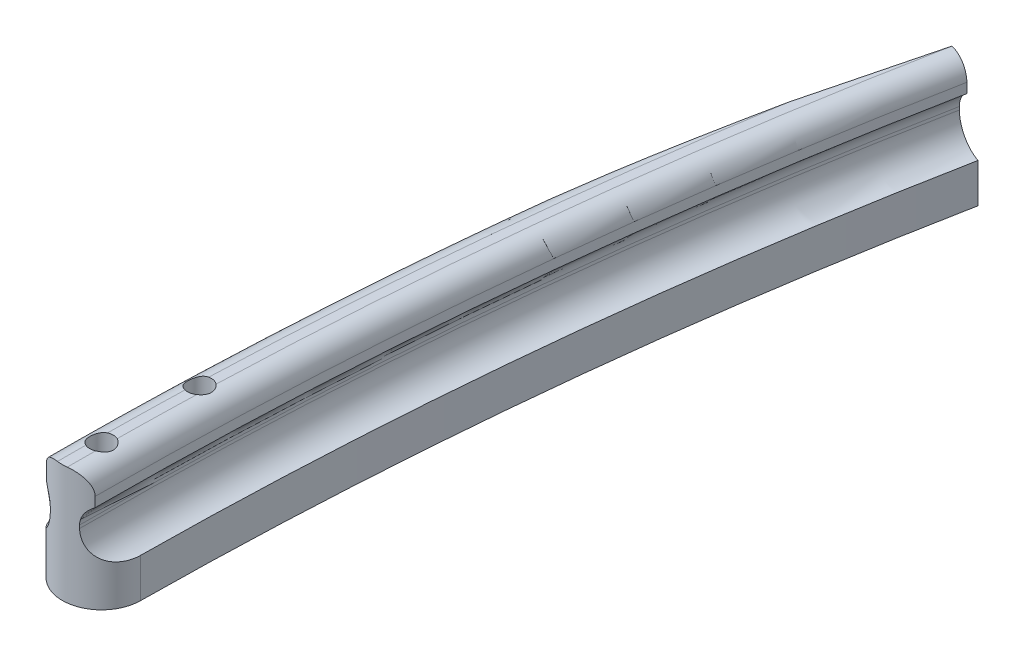
from build123d import *
from OCP.BRepAlgoAPI import BRepAlgoAPI_Cut
from OCP.TopTools import TopTools_ListOfShape

# Parameters (mm, degrees)
SKETCH_1_W                = 4
SKETCH_1_H                = 21.3823
SKETCH_1_H_2              = 8
EXTRUDE_1_DEPTH           = 4
SKETCH_1_7_W              = 44.5
SKETCH_1_7_H              = 8
EXTRUDE_2_DEPTH           = 3.5
SKETCH_2_W                = 18.5
SKETCH_2_H                = 1.5
CUT_EXTRUDE_1_DEPTH       = 38.072659107
SKETCH_2_3_W              = 2.5
SKETCH_2_3_H              = 1.5
EXTRUDE_4_DEPTH           = 29.3823
FILLET_1_R                = 1
FILLET_2_R                = 1.5
FILLET_3_R                = 1
REVOLVE_2_ANGLE           = 30
CUT_EXTRUDE_5_DEPTH       = 112.412872349
CUT_EXTRUDE_START         = -9
CUT_EXTRUDE_6_DEPTH       = 10
SKETCH_9_W                = 32.627713819
SKETCH_9_H                = 2
CUT_EXTRUDE_7_DEPTH       = 126.089275919
CUT_EXTRUDE_8_DEPTH       = 126.089275919
CUT_EXTRUDE_START_2       = -49.267691206
CUT_EXTRUDE_9_DEPTH       = 49.267691206
SKETCH_16_R               = 0.6
CUT_EXTRUDE_10_DEPTH      = 69.120571654
SKETCH_18_R               = 0.6
CUT_EXTRUDE_11_DEPTH      = 69.120571654
CUT_EXTRUDE_12_DEPTH      = 69.325780514
CUT_EXTRUDE_13_DEPTH      = 65.449078785
CUT_EXTRUDE_14_DEPTH      = 45.022808236
CUT_EXTRUDE_14_DEPTH_BACK = 45.022808236
SKETCH_21_W               = 59.665391343
SKETCH_21_H               = 19.859042977
CUT_EXTRUDE_15_DEPTH      = 60.110082836


with BuildPart() as part:
    # 草图1 → 凸台-拉伸1 (new body)
    with BuildSketch(Plane(origin=(0, 0, 0), x_dir=(1, 0, 0), z_dir=(0, 1, 0))):
        with Locations((-15.75, -4)):
            Rectangle(SKETCH_1_W, SKETCH_1_H)
        with Locations((15.75, -4)):
            Rectangle(SKETCH_1_W, SKETCH_1_H)
        with Locations((15.75, 10.69115)):
            Rectangle(SKETCH_1_W, SKETCH_1_H_2)
        with Locations((-15.75, 10.69115)):
            Rectangle(SKETCH_1_W, SKETCH_1_H_2)
    extrude(amount=EXTRUDE_1_DEPTH)

    # 草图1<7> → 凸台-拉伸2 (add)
    with BuildSketch(Plane(origin=(0, 0, 0), x_dir=(1, 0, 0), z_dir=(0, 1, 0))):
        with Locations((0, 10.69115)):
            Rectangle(SKETCH_1_7_W, SKETCH_1_7_H)
    extrude(amount=EXTRUDE_2_DEPTH)

    # 草图2 → 切除-拉伸1 (cut, through all)
    with BuildSketch(Plane(origin=(0, 0, -14.69115), x_dir=(-1, 0, 0), z_dir=(0, 0, -1))):
        with Locations((0, 2.75)):
            Rectangle(SKETCH_2_W, SKETCH_2_H)
        Polygon((13.25, 3.5), (9.25, 3.5), (9.25, 2), align=None)
        Polygon((-9.25, 3.5), (-13.25, 3.5), (-9.25, 2), align=None)
        Polygon((-22.25, 3.5), (-22.25, 2), (-18.25, 3.5), align=None)
        Polygon((22.25, 3.5), (18.25, 3.5), (22.25, 2), align=None)
    extrude(amount=-CUT_EXTRUDE_1_DEPTH, mode=Mode.SUBTRACT)

    # 草图2<3> → 凸台-拉伸4 (add, through all)
    with BuildSketch(Plane(origin=(0, 0, -14.69115), x_dir=(-1, 0, 0), z_dir=(0, 0, -1))):
        with Locations((-15.75, 7.25)):
            Rectangle(SKETCH_2_3_W, SKETCH_2_3_H)
        Polygon((-15, 6.5), (-16.5, 6.5), (-16.5, 4), (-15.75, 4), (-15, 4), align=None)
        with Locations((15.75, 7.25)):
            Rectangle(SKETCH_2_3_W, SKETCH_2_3_H)
        Polygon((16.5, 6.5), (15, 6.5), (15, 4), (15.75, 4), (16.5, 4), align=None)
    extrude(amount=-EXTRUDE_4_DEPTH)

    # 圆角1
    # the kernel refuses this fillet: 1 mm, written as the material it adds along each edge
    with BuildSketch(Plane(origin=(-16.5, 6.5, -14.69115), x_dir=(-1, 0, 0), z_dir=(0, 0, 1)), Plane(origin=(15, 6.5, -14.69115), x_dir=(-1, 0, 0), z_dir=(0, 0, 1))) as fillet_1_piece_1:
        with BuildLine():
            CenterArc((1, 0.866025404), FILLET_1_R, 180, 60)
            Line((0, 0.866025404), (-0.02, 0.866025404))
            Line((-0.02, 0.866025404), (-0.02, 0))
            Line((-0.02, 0), (0, -0.02))
            ThreePointArc((0, -0.02), (0.25, -0.02), (0.49, -0.017320508))
            Line((0.49, -0.017320508), (0.5, 0))
        make_face()
    extrude(amount=29.3823)
    with BuildSketch(Plane(origin=(-15, 6.5, -14.69115), x_dir=(0, -1, 0), z_dir=(0, 0, 1)), Plane(origin=(16.5, 6.5, -14.69115), x_dir=(0, -1, 0), z_dir=(0, 0, 1))) as fillet_1_piece_2:
        with BuildLine():
            CenterArc((0.866025404, 1), FILLET_1_R, 210, 60)
            Line((0, 0.5), (-0.017320508, 0.49))
            ThreePointArc((-0.017320508, 0.49), (-0.02, 0.25), (-0.02, 0))
            Line((-0.02, 0), (0, -0.02))
            Line((0, -0.02), (0.866025404, -0.02))
            Line((0.866025404, -0.02), (0.866025404, 0))
        make_face()
    extrude(amount=29.3823)

    # 圆角2
    # the kernel refuses this fillet: 1.5 mm, written as the material it adds along each edge
    with BuildSketch(Plane(origin=(16.5, 4, -14.69115), x_dir=(1, 0, 0), z_dir=(0, 0, 1))) as fillet_2_piece_1:
        with BuildLine():
            CenterArc((1.5, 1.479019946), FILLET_2_R, 180, 80.405931773)
            Line((0, 1.479019946), (-0.03, 1.479019946))
            Line((-0.03, 1.479019946), (-0.03, 0))
            Line((-0.03, 0), (0, -0.03))
            ThreePointArc((0, -0.03), (0.625, -0.03), (1.245, -0.029580399))
            Line((1.245, -0.029580399), (1.25, 0))
        make_face()
    extrude(amount=29.3823)
    with BuildSketch(Plane(origin=(15, 4, -14.69115), x_dir=(0, 1, 0), z_dir=(0, 0, 1)), Plane(origin=(-16.5, 4, -14.69115), x_dir=(0, 1, 0), z_dir=(0, 0, 1))) as fillet_2_piece_2:
        with BuildLine():
            CenterArc((1.479019946, 1.5), FILLET_2_R, 189.594068227, 80.405931773)
            Line((0, 1.25), (-0.029580399, 1.245))
            ThreePointArc((-0.029580399, 1.245), (-0.03, 0.625), (-0.03, 0))
            Line((-0.03, 0), (0, -0.03))
            Line((0, -0.03), (1.479019946, -0.03))
            Line((1.479019946, -0.03), (1.479019946, 0))
        make_face()
    extrude(amount=29.3823)
    with BuildSketch(Plane(origin=(-15, 4, -14.69115), x_dir=(0, 1, 0), z_dir=(0, 0, 1))) as fillet_2_piece_3:
        with BuildLine():
            CenterArc((1.479019946, -1.5), FILLET_2_R, 90, 80.405931773)
            Line((0, -1.25), (-0.029580399, -1.245))
            ThreePointArc((-0.029580399, -1.245), (-0.03, -0.625), (-0.03, 0))
            Line((-0.03, 0), (0, 0.03))
            Line((0, 0.03), (1.479019946, 0.03))
            Line((1.479019946, 0.03), (1.479019946, 0))
        make_face()
    extrude(amount=29.3823)

    # 圆角3
    fillet_3_edges = [part.edges().sort_by_distance(p)[0] for p in [
        (14.5, 8, 0),
        (17, 8, 0),
        (-17, 8, 0),
        (-14.5, 8, 0),
    ]]
    fillet(fillet_3_edges, radius=FILLET_3_R)

    # 草图7 → 旋转2 (revolve)
    with BuildSketch(Plane(origin=(0, 0, -14.69115), x_dir=(-1, 0, 0), z_dir=(0, 0, -1))):
        with BuildLine():
            Line((-17.75, 4), (-17.75, 3.5))
            Line((-17.75, 3.5), (-17.75, 0))
            Line((-17.75, 0), (-13.75, 0))
            Line((-13.75, 0), (-13.75, 3.5))
            Line((-13.75, 3.5), (-13.75, 4))
            ThreePointArc((-13.75, 4), (-14.645643924, 4.510774109), (-15, 5.479019946))
            Line((-15, 5.479019946), (-15, 5.633974596))
            ThreePointArc((-15, 5.633974596), (-14.866025404, 6.133974596), (-14.5, 6.5))
            Line((-14.5, 6.5), (-14.5, 7))
            ThreePointArc((-14.5, 7), (-14.792893219, 7.707106781), (-15.5, 8))
            Line((-15.5, 8), (-16, 8))
            ThreePointArc((-16, 8), (-16.707106781, 7.707106781), (-17, 7))
            Line((-17, 7), (-17, 6.5))
            ThreePointArc((-17, 6.5), (-16.633974596, 6.133974596), (-16.5, 5.633974596))
            Line((-16.5, 5.633974596), (-16.5, 5.479019946))
            ThreePointArc((-16.5, 5.479019946), (-16.854356076, 4.510774109), (-17.75, 4))
        make_face()
    revolve(axis=Axis((-200, 10, -14.69115), (0, 1, 0)), revolution_arc=REVOLVE_2_ANGLE)

    # 草图5 → 切除-拉伸5 (cut, through all)
    with BuildSketch(Plane(origin=(0, 0, -14.69115), x_dir=(-1, 0, 0), z_dir=(0, 0, -1))):
        with BuildLine():
            Line((17, 6.5), (17, 7))
            ThreePointArc((17, 7), (16.707106781, 7.707106781), (16, 8))
            Line((16, 8), (15.5, 8))
            ThreePointArc((15.5, 8), (14.792893219, 7.707106781), (14.5, 7))
            Line((14.5, 7), (14.5, 6.5))
            ThreePointArc((14.5, 6.5), (14.866025404, 6.133974596), (15, 5.633974596))
            Line((15, 5.633974596), (15, 5.479019946))
            ThreePointArc((15, 5.479019946), (14.645643924, 4.510774109), (13.75, 4))
            Line((13.75, 4), (13.75, 3.5))
            Line((13.75, 3.5), (13.25, 3.5))
            Line((13.25, 3.5), (9.25, 2))
            Line((9.25, 2), (-9.25, 2))
            Line((-9.25, 2), (-13.25, 3.5))
            Line((-13.25, 3.5), (-13.75, 3.5))
            Line((-13.75, 3.5), (-13.75, 4))
            ThreePointArc((-13.75, 4), (-14.645643924, 4.510774109), (-15, 5.479019946))
            Line((-15, 5.479019946), (-15, 5.633974596))
            ThreePointArc((-15, 5.633974596), (-14.866025404, 6.133974596), (-14.5, 6.5))
            Line((-14.5, 6.5), (-14.5, 7))
            ThreePointArc((-14.5, 7), (-14.792893219, 7.707106781), (-15.5, 8))
            Line((-15.5, 8), (-16, 8))
            ThreePointArc((-16, 8), (-16.707106781, 7.707106781), (-17, 7))
            Line((-17, 7), (-17, 6.5))
            ThreePointArc((-17, 6.5), (-16.633974596, 6.133974596), (-16.5, 5.633974596))
            Line((-16.5, 5.633974596), (-16.5, 5.479019946))
            ThreePointArc((-16.5, 5.479019946), (-16.854356076, 4.510774109), (-17.75, 4))
            Line((-17.75, 4), (-17.75, 3.5))
            Line((-17.75, 3.5), (-18.25, 3.5))
            Line((-18.25, 3.5), (-22.25, 2))
            Line((-22.25, 2), (-22.25, 0))
            Line((-22.25, 0), (22.25, 0))
            Line((22.25, 0), (22.25, 2))
            Line((22.25, 2), (18.25, 3.5))
            Line((18.25, 3.5), (17.75, 3.5))
            Line((17.75, 3.5), (17.75, 4))
            ThreePointArc((17.75, 4), (16.854356076, 4.510774109), (16.5, 5.479019946))
            Line((16.5, 5.479019946), (16.5, 5.633974596))
            ThreePointArc((16.5, 5.633974596), (16.633974596, 6.133974596), (17, 6.5))
        make_face()
    extrude(amount=-CUT_EXTRUDE_5_DEPTH, mode=Mode.SUBTRACT)

    # 切除-拉伸6: read off the stored shape, not the designer's step
    # 切除-拉伸6 outline → 切除-拉伸6 (cut)
    with BuildSketch(Plane.XZ.offset(CUT_EXTRUDE_START)):
        with BuildLine():
            Line((15.740729812, -14.69115), (13.75, -14.69115))
            ThreePointArc((13.75, -14.69115), (13.747703924, -15.681890654), (13.740815747, -16.672610023))
            ThreePointArc((13.740815747, -16.672610023), (14.333086384, -15.270396687), (15.740729812, -14.69115))
        make_face()
        with BuildLine():
            ThreePointArc((17.740643878, -16.709689977), (17.747660957, -15.70043083), (17.75, -14.69115))
            Line((17.75, -14.69115), (15.740729812, -14.69115))
            ThreePointArc((15.740729812, -14.69115), (17.161483126, -15.283506571), (17.740643878, -16.709689977))
        make_face()
    extrude(amount=CUT_EXTRUDE_6_DEPTH, mode=Mode.SUBTRACT)

    # 草图9 → 切除-拉伸7 (cut, through all)
    with BuildSketch(Plane.XY):
        with Locations((1.426786968, 1)):
            Rectangle(SKETCH_9_W, SKETCH_9_H)
    extrude(amount=-CUT_EXTRUDE_7_DEPTH, mode=Mode.SUBTRACT)

    # 草图13 → 切除-拉伸8 (cut, through all)
    with BuildSketch(Plane(origin=(0, 8, 0), x_dir=(1, 0, 0), z_dir=(0, 1, 0))):
        Polygon((16.010534911, 67.272147588), (-7.329315732, 60.975271536), (-25.509234379, 137.795453838), (-4.693944012, 144.014875523), align=None)
    extrude(amount=-CUT_EXTRUDE_8_DEPTH, mode=Mode.SUBTRACT)


with BuildPart() as cut_extrude_9_tool:
    # 切除-拉伸9: read off the stored shape, not the designer's step
    # 切除-拉伸9 outline → 切除-拉伸9 (new body)
    with BuildSketch(Plane(origin=(-15.831701273, 0, -58.681406476), x_dir=(-0.9654799025758982, 0, 0.26047755704097475), z_dir=(-0.2604775570409747, 0, -0.9654799025758981)).offset(CUT_EXTRUDE_START_2)):
        with BuildLine():
            add(Edge.make_bspline(
                [(-26.160537299, 7.999998424), (-26.121993875, 7.999997186), (-26.08345031, 7.997770563), (-25.989275294, 7.986839423), (-25.933934895, 7.975627276), (-25.825922284, 7.944070731), (-25.773250062, 7.923726363), (-25.672071361, 7.874483013), (-25.623564731, 7.845584343), (-25.532095564, 7.780052945), (-25.489132751, 7.743420606), (-25.409984814, 7.66347655), (-25.373797132, 7.620167366), (-25.309197596, 7.528069909), (-25.280788196, 7.479279913), (-25.232562577, 7.377616897), (-25.212748824, 7.324742709), (-25.182312299, 7.216458966), (-25.171675504, 7.161053415), (-25.163907361, 7.087699297), (-25.162517019, 7.07013274), (-25.160671327, 7.035046347), (-25.160210933, 7.017526777), (-25.160209944, 7)],
                knots=[1.569539872, 1.569539872, 1.569539872, 1.569539872, 1.685033124, 1.685033124, 1.853625994, 1.853625994, 2.022218312, 2.022218312, 2.190804502, 2.190804502, 2.35938225, 2.35938225, 2.527896204, 2.527896204, 2.696463261, 2.696463261, 2.865078641, 2.865078641, 3.033435924, 3.033435924, 3.086283215, 3.086283215, 3.138843098, 3.138843098, 3.138843098, 3.138843098], degree=3))
            Line((-26.160537299, 7.999998424), (-26.660699845, 7.999998424))
            add(Edge.make_bspline(
                [(-27.661022687, 7), (-27.661022504, 7.028060696), (-27.659840464, 7.056108011), (-27.655119198, 7.112069239), (-27.651574493, 7.13998269), (-27.637429693, 7.223075643), (-27.623318842, 7.277699168), (-27.586127728, 7.383799255), (-27.563043332, 7.435274354), (-27.508564404, 7.533616697), (-27.477171485, 7.580484832), (-27.40696018, 7.668293154), (-27.368140579, 7.709232369), (-27.284175022, 7.784021722), (-27.239028096, 7.817870771), (-27.143681646, 7.877519888), (-27.09348081, 7.903317859), (-26.989464676, 7.946120801), (-26.935649604, 7.963126319), (-26.825911939, 7.987869077), (-26.769988702, 7.995603462), (-26.696125362, 7.999529581), (-26.678412618, 7.999998993), (-26.660699845, 7.999998424)],
                knots=[0.000199877, 0.000199877, 0.000199877, 0.000199877, 0.084330442, 0.084330442, 0.168656793, 0.168656793, 0.337038708, 0.337038708, 0.505498265, 0.505498265, 0.673925161, 0.673925161, 0.842379637, 0.842379637, 1.010859962, 1.010859962, 1.179384125, 1.179384125, 1.347897796, 1.347897796, 1.516463342, 1.516463342, 1.569538693, 1.569538693, 1.569538693, 1.569538693], degree=3))
            Line((-27.661022687, 7), (-27.661022693, 6.499999993))
            add(Edge.make_bspline(
                [(-27.16086164, 5.633974596), (-27.160861719, 5.662050942), (-27.162045141, 5.690114022), (-27.166771795, 5.746106343), (-27.170320501, 5.774035122), (-27.1844702, 5.857111045), (-27.198574914, 5.911702521), (-27.235753479, 6.017762657), (-27.258834489, 6.069228786), (-27.313302438, 6.167567636), (-27.344691408, 6.214439228), (-27.418624307, 6.306887494), (-27.461993001, 6.351812519), (-27.532718296, 6.412602472), (-27.557291177, 6.431796511), (-27.608009033, 6.467733873), (-27.634146776, 6.4844874), (-27.661022693, 6.499999993)],
                knots=[0.000199878, 0.000199878, 0.000199878, 0.000199878, 0.084377582, 0.084377582, 0.168750756, 0.168750756, 0.337038792, 0.337038792, 0.505461316, 0.505461316, 0.673925056, 0.673925056, 0.860061179, 0.860061179, 0.953486913, 0.953486913, 1.046510009, 1.046510009, 1.046510009, 1.046510009], degree=3))
            Line((-27.16086164, 5.633974596), (-27.160861604, 5.479019946))
            add(Edge.make_bspline(
                [(-28.411262876, 4.000000008), (-28.370029739, 4.006967758), (-28.329107236, 4.015655942), (-28.247742777, 4.036513194), (-28.207309134, 4.048714692), (-28.08783509, 4.090355468), (-28.01049231, 4.124852896), (-27.862697557, 4.206343779), (-27.792249049, 4.253343477), (-27.660255752, 4.358494936), (-27.598708182, 4.416643203), (-27.486273953, 4.542424711), (-27.435383523, 4.610054584), (-27.345650214, 4.752947949), (-27.306815033, 4.82821628), (-27.242326505, 4.984230444), (-27.216679212, 5.064978773), (-27.179372025, 5.229507916), (-27.167681742, 5.313281729), (-27.161600474, 5.424556515), (-27.160856812, 5.45179501), (-27.160861604, 5.479019946)],
                knots=[0.001202493, 0.001202493, 0.001202493, 0.001202493, 0.126579738, 0.126579738, 0.253153562, 0.253153562, 0.505912912, 0.505912912, 0.758798687, 0.758798687, 1.011605313, 1.011605313, 1.264322315, 1.264322315, 1.517200369, 1.517200369, 1.770194383, 1.770194383, 2.022636532, 2.022636532, 2.104337931, 2.104337931, 2.104337931, 2.104337931], degree=3))
            Line((-28.411262876, 4.000000008), (-28.411262874, 2))
            Line((-28.411262874, 2), (-24.409962397, 2))
            Line((-24.409962397, 2), (-24.409962432, 3.999999793))
            add(Edge.make_bspline(
                [(-25.660373995, 5.479019946), (-25.660373719, 5.436896809), (-25.658597943, 5.394793793), (-25.651508031, 5.310821743), (-25.64618847, 5.268953166), (-25.62496338, 5.144314582), (-25.60379133, 5.062378933), (-25.547992013, 4.903226755), (-25.513358134, 4.826012566), (-25.431628729, 4.678505956), (-25.384537026, 4.608211422), (-25.279228051, 4.476526079), (-25.221010995, 4.415135097), (-25.09505817, 4.302954312), (-25.027316357, 4.25217129), (-24.88420556, 4.16264898), (-24.808828423, 4.123922751), (-24.652758935, 4.059753969), (-24.572078475, 4.03428277), (-24.463411816, 4.009776554), (-24.436742509, 4.004520241), (-24.409962432, 3.999999793)],
                knots=[0.000199877, 0.000199877, 0.000199877, 0.000199877, 0.126491847, 0.126491847, 0.252977568, 0.252977568, 0.505555719, 0.505555719, 0.758258082, 0.758258082, 1.010883018, 1.010883018, 1.26350304, 1.26350304, 1.5162841, 1.5162841, 1.769337996, 1.769337996, 2.021842694, 2.021842694, 2.103344969, 2.103344969, 2.103344969, 2.103344969], degree=3))
            Line((-25.660373995, 5.479019946), (-25.660373993, 5.633974596))
            add(Edge.make_bspline(
                [(-25.160209932, 6.499999999), (-25.184478281, 6.485993166), (-25.208146504, 6.470972866), (-25.254248925, 6.438925903), (-25.276676785, 6.421890121), (-25.341595174, 6.368101172), (-25.381853024, 6.3285898), (-25.455178844, 6.243354254), (-25.488240954, 6.197625066), (-25.546228596, 6.101264036), (-25.571152285, 6.050631086), (-25.614267852, 5.940412104), (-25.631494656, 5.880441993), (-25.648794147, 5.788871232), (-25.653137268, 5.75801754), (-25.65892374, 5.696106747), (-25.660373351, 5.66505023), (-25.660373993, 5.633974596)],
                knots=[0.000399994, 0.000399994, 0.000399994, 0.000399994, 0.084410261, 0.084410261, 0.16881631, 0.16881631, 0.337175076, 0.337175076, 0.505670414, 0.505670414, 0.674203874, 0.674203874, 0.860199571, 0.860199571, 0.953556827, 0.953556827, 1.046711929, 1.046711929, 1.046711929, 1.046711929], degree=3))
            Line((-25.160209932, 6.499999999), (-25.160209944, 7))
        make_face()
    extrude(amount=CUT_EXTRUDE_9_DEPTH)


with BuildPart() as part_1:
    add(part.part)

    # 切除-拉伸9: cut by cut_extrude_9_tool, with a tolerance
    cut_extrude_9_stock = TopTools_ListOfShape()
    cut_extrude_9_stock.Append(part_1.part.wrapped)
    cut_extrude_9_tools = TopTools_ListOfShape()
    cut_extrude_9_tools.Append(cut_extrude_9_tool.part.wrapped)
    cut_extrude_9_cut = BRepAlgoAPI_Cut()
    cut_extrude_9_cut.SetArguments(cut_extrude_9_stock)
    cut_extrude_9_cut.SetTools(cut_extrude_9_tools)
    cut_extrude_9_cut.SetFuzzyValue(0.00001)
    cut_extrude_9_cut.Build()
    add(Compound.cast(cut_extrude_9_cut.Shape()).solids(), mode=Mode.REPLACE)

    # 草图16 → 切除-拉伸10 (cut, through all)
    with BuildSketch(Plane(origin=(0, 2, 0), x_dir=(-1, 0, 0), z_dir=(0, -1, 0))):
        with Locations(Location((-15.740729812, 16.69115, 0), (0, 0, 90))):
            Circle(SKETCH_16_R)
    extrude(amount=-CUT_EXTRUDE_10_DEPTH, mode=Mode.SUBTRACT)

    # 草图18 → 切除-拉伸11 (cut, through all)
    with BuildSketch(Plane(origin=(0, 2, 0), x_dir=(-1, 0, 0), z_dir=(0, -1, 0))):
        with Locations(Location((-15.750072705, 21.69115, 0), (0, 0, 90))):
            Circle(SKETCH_18_R)
    extrude(amount=-CUT_EXTRUDE_11_DEPTH, mode=Mode.SUBTRACT)

    # 草图19 → 切除-拉伸12 (cut, through all)
    with BuildSketch(Plane(origin=(0, 8, 0), x_dir=(1, 0, 0), z_dir=(0, 1, 0))):
        Polygon((9.42577173, 65.495639323), (10.519777469, 61.440623732), (7.474418334, 60.619013975), (6.380412595, 64.674029566), align=None)
    extrude(amount=-CUT_EXTRUDE_12_DEPTH, mode=Mode.SUBTRACT)

    # 草图20 → 切除-拉伸13 (cut, through all)
    with BuildSketch(Plane(origin=(0, 8, 0), x_dir=(1, 0, 0), z_dir=(0, 1, 0))):
        Polygon((5.321922206, 54.282572393), (14.884942443, 56.718718169), (11.824728013, 71.430358659), (2.577892141, 69.094191063), align=None)
    extrude(amount=-CUT_EXTRUDE_13_DEPTH, mode=Mode.SUBTRACT)

    # 草图12 → 切除-拉伸14 (cut, two sides: drawn at the far end of the back side and taken through both)
    with BuildSketch(Plane(origin=(-4.6452924, 0, -51.743459523), x_dir=(0.9690505868068372, 0, -0.24686222920755765), z_dir=(0.24686222920755765, 0, 0.9690505868068372)).offset(-CUT_EXTRUDE_14_DEPTH_BACK)):
        with BuildLine():
            Line((14.939240455, 4), (14.939240455, 0))
            Line((14.939240455, 0), (18.939240455, 0))
            Line((18.939240455, 0), (18.939240455, 4))
            ThreePointArc((18.939240455, 4), (18.043596532, 4.510774109), (17.689240455, 5.479019946))
            Line((17.689240455, 5.479019946), (17.689240455, 5.633974596))
            ThreePointArc((17.689240455, 5.633974596), (17.823215052, 6.133974596), (18.189240455, 6.5))
            Line((18.189240455, 6.5), (18.189240455, 7))
            ThreePointArc((18.189240455, 7), (17.896347236, 7.707106781), (17.189240455, 8))
            Line((17.189240455, 8), (16.689240455, 8))
            ThreePointArc((16.689240455, 8), (15.982133674, 7.707106781), (15.689240455, 7))
            Line((15.689240455, 7), (15.689240455, 6.5))
            ThreePointArc((15.689240455, 6.5), (16.055265859, 6.133974596), (16.189240455, 5.633974596))
            Line((16.189240455, 5.633974596), (16.189240455, 5.479019946))
            ThreePointArc((16.189240455, 5.479019946), (15.834884379, 4.510774109), (14.939240455, 4))
        make_face()
    extrude(amount=CUT_EXTRUDE_14_DEPTH + CUT_EXTRUDE_14_DEPTH_BACK, mode=Mode.SUBTRACT)


with BuildPart() as body_2:
    # 镜向1: mirrored copy
    add(part_1.part.mirror(Plane(origin=(0, 0, 0), x_dir=(0, 0, 1), z_dir=(1, 0, 0))))


with BuildPart() as part_2:
    add(part_1.part)

    # 草图21 → 切除-拉伸15 (cut, through all)
    with BuildSketch(Plane(origin=(0, 0, 0), x_dir=(0, 0, -1), z_dir=(1, 0, 0))):
        with Locations((35.97624749, 0.882624133)):
            Rectangle(SKETCH_21_W, SKETCH_21_H)
    extrude(amount=CUT_EXTRUDE_15_DEPTH, mode=Mode.SUBTRACT)


solid = body_2.part
